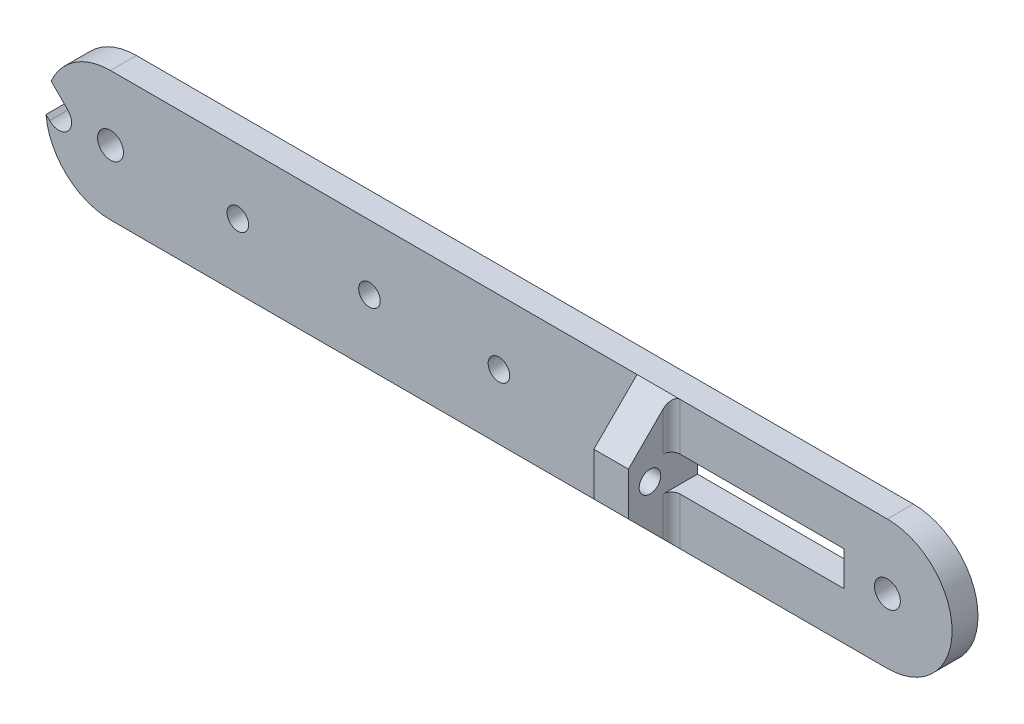
from build123d import *

# Parameters (mm, degrees)
ESQUISSE1_R             = 3
ESQUISSE1_R_2           = 2.5
ESQUISSE1_W             = 40
ESQUISSE1_H             = 8
BOSS_EXTRU_1_DEPTH      = 6
ESQUISSE2_R             = 2.5
BOSS_EXTRU_2_DEPTH      = 8
CONG_2_R                = 2
ENL_V_MAT_EXTRU_1_DEPTH = 4
ENL_V_START             = -10
ENL_V_MAT_EXTRU_4_DEPTH = 10


with BuildPart() as part:
    # Esquisse1 → Boss.-Extru.1 (new body)
    with BuildSketch(Plane.XY):
        with BuildLine():
            Line((90, -15), (-90, -15))
            ThreePointArc((-90, -15), (-105, 0), (-90, 15))
            Line((-90, 15), (90, 15))
            ThreePointArc((90, 15), (105, 0), (90, -15))
        make_face()
        with Locations((90, 0)):
            Circle(ESQUISSE1_R, mode=Mode.SUBTRACT)
        with Locations((-90, 0)):
            Circle(ESQUISSE1_R, mode=Mode.SUBTRACT)
        Circle(ESQUISSE1_R_2, mode=Mode.SUBTRACT)
        with Locations((-60.5, 0)):
            Circle(ESQUISSE1_R_2, mode=Mode.SUBTRACT)
        with Locations((-30, 0)):
            Circle(ESQUISSE1_R_2, mode=Mode.SUBTRACT)
        with Locations((60, 0)):
            Rectangle(ESQUISSE1_W, ESQUISSE1_H, mode=Mode.SUBTRACT)
    extrude(amount=BOSS_EXTRU_1_DEPTH)

    # Esquisse2 → Boss.-Extru.2 (add)
    with BuildSketch(Plane(origin=(40, 0, 0), x_dir=(0, 0, -1), z_dir=(1, 0, 0))):
        Polygon((-16, 5), (-16, -5), (-6, -15), (-6, -5), (-6, 5), (-6, 15), align=None)
        with Locations((-11, 0)):
            Circle(ESQUISSE2_R, mode=Mode.SUBTRACT)
    extrude(amount=-BOSS_EXTRU_2_DEPTH)

    # Congé2
    cong_2_edges = [part.edges().sort_by_distance(p)[0] for p in [
        (40, 9.5, 6),
        (40, -9.5, 6),
    ]]
    fillet(cong_2_edges, radius=CONG_2_R)

    # Esquisse3 → Enlèv. mat.-Extru.1 (cut)
    with BuildSketch(Plane.ZY.offset(-32)):
        Polygon((11, 4), (14.464101615, 2), (14.464101615, -2), (11, -4), (7.535898385, -2), (7.535898385, 2), align=None)
    extrude(amount=-ENL_V_MAT_EXTRU_1_DEPTH, mode=Mode.SUBTRACT)

    # Esquisse4 → Enlèv. mat.-Extru.4 (cut)
    with BuildSketch(Plane.XY.offset(6).offset(ENL_V_START)):
        with BuildLine():
            Line((-104.94364809, -1.298992597), (-104.121320344, -2.121320344))
            ThreePointArc((-104.121320344, -2.121320344), (-99.878679656, -2.121320344), (-99.878679656, 2.121320344))
            Line((-99.878679656, 2.121320344), (-103.750652313, 5.993293))
            ThreePointArc((-103.750652313, 5.993293), (-104.803211685, 2.421760475), (-104.94364809, -1.298992597))
        make_face()
    extrude(amount=ENL_V_MAT_EXTRU_4_DEPTH, mode=Mode.SUBTRACT)


solid = part.part
